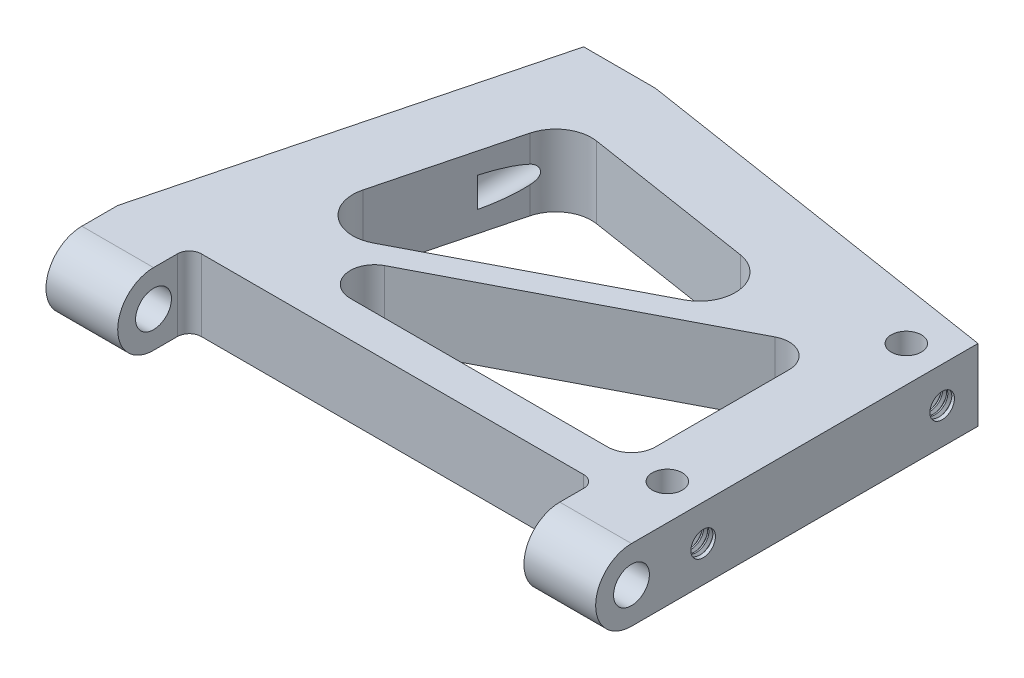
from build123d import *
from build123d.topology import SkipClean

# Parameters (mm, degrees)
BOSS_EXTRUDE1_DEPTH = 19.05
SKETCH7_R           = 3.96875
CUT_EXTRUDE7_DEPTH  = 38.1
FILLET6_RADIUS      = 9.525
FILLET6_LENGTH      = 19.05
FILLET7_RADIUS      = 9.525
FILLET7_LENGTH      = 19.05
SKETCH19_R          = 3.2639
CUT_EXTRUDE14_DEPTH = 31.75
THREAD1_PITCH       = 1.411111111
THREAD2_PITCH       = 1.411111111
SKETCH26_R          = 4
CUT_EXTRUDE15_DEPTH = 189.398197532
SKETCH27_R          = 4.7625
CUT_EXTRUDE16_DEPTH = 189.398197532


with BuildPart() as part:
    # Sketch1 → Boss-Extrude1 (new body)
    with BuildSketch(Plane(origin=(0, 0, 0), x_dir=(1, 0, 0), z_dir=(0, 1, 0))):
        with BuildLine():
            Line((0, -117.475), (19.05, -117.475))
            Line((19.05, -117.475), (19.05, -101.6))
            ThreePointArc((19.05, -101.6), (19.97993597, -99.35493597), (22.225, -98.425))
            Line((22.225, -98.425), (123.825, -98.425))
            ThreePointArc((123.825, -98.425), (126.07006403, -99.35493597), (127, -101.6))
            Line((127, -101.6), (127, -117.475))
            Line((127, -117.475), (146.05, -117.475))
            Line((146.05, -117.475), (146.05, -15.875))
            Line((146.05, -15.875), (44.45, 0))
            Line((44.45, 0), (25.4, 0))
            Line((25.4, 0), (0, -98.425))
            Line((0, -98.425), (0, -117.475))
        make_face()
        with BuildLine():
            Line((120.65, -88.9), (52.270557987, -88.9))
            ThreePointArc((52.270557987, -88.9), (46.031194372, -84.000361607), (49.31164374, -76.777151334))
            Line((49.31164374, -76.777151334), (117.618559266, -41.320505347))
            ThreePointArc((117.618559266, -41.320505347), (123.912525338, -41.532086706), (127, -47.020827527))
            Line((127, -47.020827527), (127, -82.55))
            ThreePointArc((127, -82.55), (125.140128061, -87.040128061), (120.65, -88.9))
        make_face(mode=Mode.SUBTRACT)
        with BuildLine():
            Line((96.952210685, -44.893445511), (42.617190803, -73.097581942))
            ThreePointArc((42.617190803, -73.097581942), (32.297052574, -72.096060045), (29.006098306, -62.263567015))
            Line((29.006098306, -62.263567015), (38.108481757, -26.991831143))
            ThreePointArc((38.108481757, -26.991831143), (42.098473959, -21.413093158), (48.80176305, -19.961104652))
            Line((48.80176305, -19.961104652), (94.034399481, -27.028704095))
            ThreePointArc((94.034399481, -27.028704095), (101.964401754, -34.90416399), (96.952210685, -44.893445511))
        make_face(mode=Mode.SUBTRACT)
    extrude(amount=BOSS_EXTRUDE1_DEPTH)

    # Sketch7 → Cut-Extrude7 (cut)
    with BuildSketch(Plane(origin=(0, 0, 0), x_dir=(-1, 0, 0), z_dir=(0, 0, -1))):
        with Locations((-34.925, 9.525)):
            Circle(SKETCH7_R)
    extrude(amount=-CUT_EXTRUDE7_DEPTH, mode=Mode.SUBTRACT)

    # Fillet6: full round fillet: the end face becomes a half cylinder, R = half its width
    fillet6_face = Plane((9.525, 9.525, 117.475), x_dir=(-1, 0, 0), z_dir=(0, 0, 1))  # on the end face: x along it, z out of the body
    fillet6_slab = fillet6_face.offset(-FILLET6_RADIUS / 2) * Box(FILLET6_LENGTH, 2 * FILLET6_RADIUS, FILLET6_RADIUS, mode=Mode.PRIVATE)  # the body's end, R deep
    fillet6_round = Plane((9.525, 9.525, 107.95), x_dir=(0, 0, 1), z_dir=(-1, 0, 0)) * Cylinder(FILLET6_RADIUS, FILLET6_LENGTH, mode=Mode.PRIVATE)  # its axis R under the face
    add(fillet6_slab - fillet6_round, mode=Mode.SUBTRACT)

    # Fillet7: full round fillet: the end face becomes a half cylinder, R = half its width
    fillet7_face = Plane((136.525, 9.525, 117.475), x_dir=(1, 0, 0), z_dir=(0, 0, 1))  # on the end face: x along it, z out of the body
    fillet7_slab = fillet7_face.offset(-FILLET7_RADIUS / 2) * Box(FILLET7_LENGTH, 2 * FILLET7_RADIUS, FILLET7_RADIUS, mode=Mode.PRIVATE)  # the body's end, R deep
    fillet7_round = Plane((136.525, 9.525, 107.95), x_dir=(0, 0, 1), z_dir=(1, 0, 0)) * Cylinder(FILLET7_RADIUS, FILLET7_LENGTH, mode=Mode.PRIVATE)  # its axis R under the face
    add(fillet7_slab - fillet7_round, mode=Mode.SUBTRACT)

    # Sketch19 → Cut-Extrude14 (cut)
    with BuildSketch(Plane(origin=(146.05, 0, 0), x_dir=(0, 0, -1), z_dir=(1, 0, 0))):
        with Locations((-88.9, 9.525)):
            Circle(SKETCH19_R)
        with Locations((-25.4, 9.525)):
            Circle(SKETCH19_R)
    extrude(amount=-CUT_EXTRUDE14_DEPTH, mode=Mode.SUBTRACT)

    # Thread1: the profile of Thread Profile1 profile screwed along a right-hand helix of 18 turns, 8 arcs to a turn; built about Z, then put on its axis
    with SkipClean():  # the faces are left unmerged after this step: merging them gives an invalid solid
        thread1_z = Axis((0, 0, 0), (0, 0, 1))
        thread1_corners = [(3.2636, 0, -0.000173205), (4.02768629, 0, 0.44097222), (4.02768629, 0, 0.617361109), (3.2636, 0, 1.058506535)]
        with BuildLine(mode=Mode.PRIVATE) as thread1_profile:
            Line(thread1_corners[0], thread1_corners[1])
            Line(thread1_corners[1], thread1_corners[2])
            Line(thread1_corners[2], thread1_corners[3])
            Line(thread1_corners[3], thread1_corners[0])
        thread1_cap = Face(thread1_profile.wire())
        thread1_turn_angles = [0, 22.5, 45, 67.5, 90, 112.5, 135, 157.5, 180, 202.5, 225, 247.5, 270, 292.5, 315, 337.5, 360]
        thread1_turn_weights = [1, 0.9238795325112867, 1, 0.9238795325112867, 1, 0.9238795325112867, 1, 0.9238795325112867, 1, 0.9238795325112867, 1, 0.9238795325112867, 1, 0.9238795325112867, 1, 0.9238795325112867, 1]
        thread1_turn_rails = [Edge.make_bspline([Vector(p[0], p[1], 0).rotate(thread1_z, thread1_turn_angles[k]) / thread1_turn_weights[k] + Vector(0, 0, p[2] + THREAD1_PITCH * thread1_turn_angles[k] / 360) for k in range(17)], [0, 0, 0, 1, 1, 2, 2, 3, 3, 4, 4, 5, 5, 6, 6, 7, 7, 8, 8, 8], 2, thread1_turn_weights) for p in thread1_corners]
        thread1_turn_sides = [Face.make_surface_from_curves(thread1_turn_rails[p[0]], thread1_turn_rails[p[1]]) for p in [(0, 1), (1, 2), (2, 3), (3, 0)]]
        thread1 = Plane(origin=(146.05, 9.525, 88.9), x_dir=(0, 0, 1), z_dir=(-1, 0, 0)) * Solid(Shell([*[p.moved(Location((0, 0, THREAD1_PITCH * i))) for i in range(18) for p in thread1_turn_sides], thread1_cap, thread1_cap.rotate(thread1_z, 6480).moved(Location((0, 0, THREAD1_PITCH * 6480 / 360)))]))
        add(thread1, mode=Mode.SUBTRACT)

    # Thread2: the profile of Thread Profile2 profile screwed along a right-hand helix of 18 turns, 8 arcs to a turn; built about Z, then put on its axis
    with SkipClean():  # the faces are left unmerged after this step: merging them gives an invalid solid
        thread2_z = Axis((0, 0, 0), (0, 0, 1))
        thread2_corners = [(3.2636, 0, -0.000173205), (4.02768629, 0, 0.44097222), (4.02768629, 0, 0.617361109), (3.2636, 0, 1.058506535)]
        with BuildLine(mode=Mode.PRIVATE) as thread2_profile:
            Line(thread2_corners[0], thread2_corners[1])
            Line(thread2_corners[1], thread2_corners[2])
            Line(thread2_corners[2], thread2_corners[3])
            Line(thread2_corners[3], thread2_corners[0])
        thread2_cap = Face(thread2_profile.wire())
        thread2_turn_angles = [0, 22.5, 45, 67.5, 90, 112.5, 135, 157.5, 180, 202.5, 225, 247.5, 270, 292.5, 315, 337.5, 360]
        thread2_turn_weights = [1, 0.9238795325112867, 1, 0.9238795325112867, 1, 0.9238795325112867, 1, 0.9238795325112867, 1, 0.9238795325112867, 1, 0.9238795325112867, 1, 0.9238795325112867, 1, 0.9238795325112867, 1]
        thread2_turn_rails = [Edge.make_bspline([Vector(p[0], p[1], 0).rotate(thread2_z, thread2_turn_angles[k]) / thread2_turn_weights[k] + Vector(0, 0, p[2] + THREAD2_PITCH * thread2_turn_angles[k] / 360) for k in range(17)], [0, 0, 0, 1, 1, 2, 2, 3, 3, 4, 4, 5, 5, 6, 6, 7, 7, 8, 8, 8], 2, thread2_turn_weights) for p in thread2_corners]
        thread2_turn_sides = [Face.make_surface_from_curves(thread2_turn_rails[p[0]], thread2_turn_rails[p[1]]) for p in [(0, 1), (1, 2), (2, 3), (3, 0)]]
        thread2 = Plane(origin=(146.05, 9.525, 25.4), x_dir=(0, 0, 1), z_dir=(-1, 0, 0)) * Solid(Shell([*[p.moved(Location((0, 0, THREAD2_PITCH * i))) for i in range(18) for p in thread2_turn_sides], thread2_cap, thread2_cap.rotate(thread2_z, 6480).moved(Location((0, 0, THREAD2_PITCH * 6480 / 360)))]))
        add(thread2, mode=Mode.SUBTRACT)

    # Sketch26 → Cut-Extrude15 (cut, through all)
    with SkipClean():  # the faces are left unmerged after this step: merging them gives an invalid solid
        with BuildSketch(Plane(origin=(0, 19.05, 0), x_dir=(1, 0, 0), z_dir=(0, 1, 0))):
            with Locations(Location((136.525, -25.4, 0), (0, 0, 270))):
                Circle(SKETCH26_R)
            with Locations(Location((136.525, -88.9, 0), (0, 0, 270))):
                Circle(SKETCH26_R)
        extrude(amount=-CUT_EXTRUDE15_DEPTH, mode=Mode.SUBTRACT)

    # Sketch27 → Cut-Extrude16 (cut, through all)
    with SkipClean():  # the faces are left unmerged after this step: merging them gives an invalid solid
        with BuildSketch(Plane.ZY):
            with Locations((107.95, 9.525)):
                Circle(SKETCH27_R)
        extrude(amount=-CUT_EXTRUDE16_DEPTH, mode=Mode.SUBTRACT)


solid = part.part
